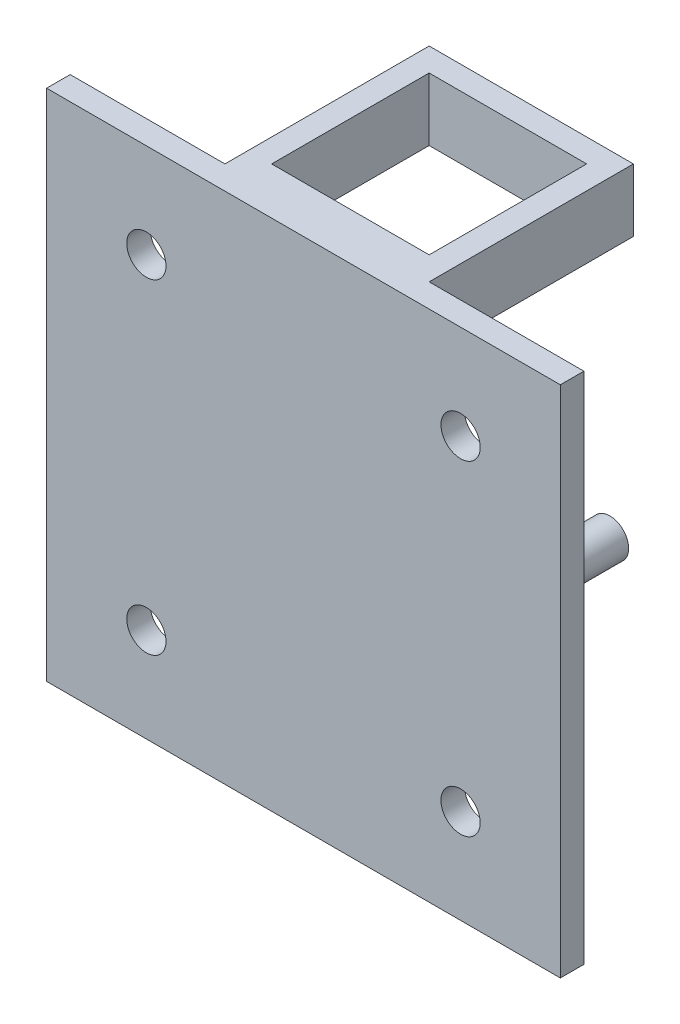
from build123d import *

# Parameters (mm, degrees)
SKETCH_1_W            = 65.4
SKETCH_1_H            = 65.4
SKETCH_1_R            = 2.5
EXTRUDE_439_DEPTH     = 3
SKETCH_2_W            = 26
SKETCH_2_H            = 8
EXTRUDE_674_DEPTH     = 26
SKETCH_3_W            = 20.05
SKETCH_3_H            = 20.05
CUT_EXTRUDE_881_DEPTH = 91.818059878
SKETCH_4_R            = 5
SKETCH_4_R_2          = 2
EXTRUDE_1196_DEPTH    = 6.6
SKETCH_5_R            = 2.4
EXTRUDE_1_DEPTH       = 16


with BuildPart() as part:
    # Эскиз1 → Extrude 439 (new body)
    with BuildSketch(Plane.XY):
        with Locations((-32.7, 32.7)):
            Rectangle(SKETCH_1_W, SKETCH_1_H)
        with Locations((-52.7, 53.4)):
            Circle(SKETCH_1_R, mode=Mode.SUBTRACT)
        with Locations((-12.7, 53.4)):
            Circle(SKETCH_1_R, mode=Mode.SUBTRACT)
        with Locations((-12.7, 12)):
            Circle(SKETCH_1_R, mode=Mode.SUBTRACT)
        with Locations((-52.7, 12)):
            Circle(SKETCH_1_R, mode=Mode.SUBTRACT)
    extrude(amount=EXTRUDE_439_DEPTH)

    # Эскиз2 → Extrude 674 (add)
    with BuildSketch(Plane(origin=(0, 0, 0), x_dir=(-1, 0, 0), z_dir=(0, 0, -1))):
        with Locations((32.7, 61.4)):
            Rectangle(SKETCH_2_W, SKETCH_2_H)
    extrude(amount=EXTRUDE_674_DEPTH)

    # Эскиз3 → Cut-Extrude 881 (cut, through all)
    with BuildSketch(Plane.XZ.offset(-57.4)):
        with Locations((-32.7, -13)):
            Rectangle(SKETCH_3_W, SKETCH_3_H)
    extrude(amount=-CUT_EXTRUDE_881_DEPTH, mode=Mode.SUBTRACT)

    # Эскиз4 → Extrude 1196 (add)
    with BuildSketch(Plane(origin=(0, 0, 0), x_dir=(-1, 0, 0), z_dir=(0, 0, -1))):
        with Locations((52.7, 32.7)):
            Circle(SKETCH_4_R)
        with Locations((52.7, 32.7)):
            Circle(SKETCH_4_R_2, mode=Mode.SUBTRACT)
    extrude(amount=EXTRUDE_1196_DEPTH)

    # Эскиз5 → Бобышка-Вытянуть1 (add)
    with BuildSketch(Plane(origin=(0, 0, 0), x_dir=(-1, 0, 0), z_dir=(0, 0, -1))):
        with Locations((12.7, 32.7)):
            Circle(SKETCH_5_R)
    extrude(amount=EXTRUDE_1_DEPTH)


solid = part.part
